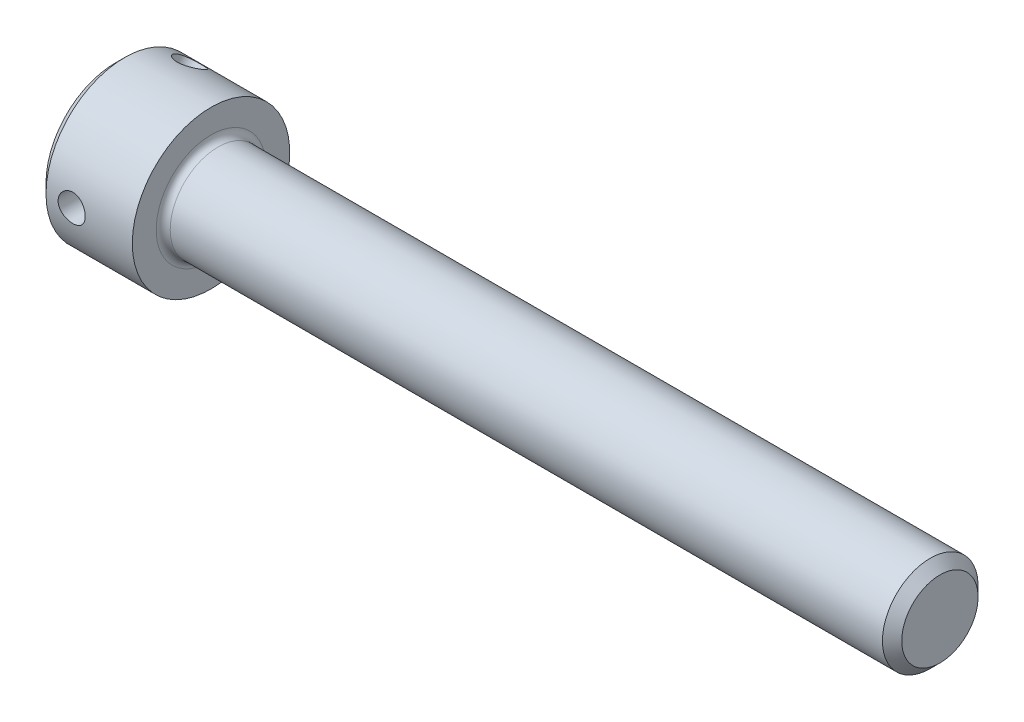
from build123d import *

# Parameters (mm, degrees)
FILLET1_R       = 0.3048
HEX_2_DEPTH     = 1.9558
SKETCH5_R       = 0.59055
HOLE_DEPTH      = 37.241501147
DRILLED_4_COUNT = 2
DRILLED_4_ANGLE = 60


with BuildPart() as part:
    # BodySke → Base-Revolve (revolve)
    with BuildSketch(Plane.XY):
        Polygon((0, 0), (0, 3.0226), (0.4064, 3.429), (4.1656, 3.429), (4.1656, 2.0828), (35.49523, 2.0828), (35.9156, 1.66243), (35.9156, 0), align=None)
    revolve(axis=Axis((-31.75, 0, 0), (1, 0, 0)))

    # Fillet1
    fillet1_edges = [part.edges().sort_by_distance(p)[0] for p in [
        (4.1656, -2.0828, 0),
    ]]
    fillet(fillet1_edges, radius=FILLET1_R)

    # Sketch2 → Hex-PreBroach (revolve, cut)
    with BuildSketch(Plane.XY):
        Polygon((0, 1.778), (1.9558, 1.778), (2.982328779, 0), (0, 0), align=None)
    revolve(axis=Axis((0, 0, 0), (1, 0, 0)), mode=Mode.SUBTRACT)

    # Sketch3 → Hex 2 (cut)
    with BuildSketch(Plane(origin=(0, 0, 0), x_dir=(0, 0.500000000000001, 0.866025403784438), z_dir=(-1, 0, 0))):
        Polygon((1.026528779, 1.778), (-1.026528779, 1.778), (-2.053057557, 0), (-1.026528779, -1.778), (1.026528779, -1.778), (2.053057557, 0), align=None)
    extrude(amount=-HEX_2_DEPTH, mode=Mode.SUBTRACT)

    # Sketch5 → Hole (cut, symmetric)
    with BuildSketch(Plane.XY):
        with Locations((1.524, 0)):
            Circle(SKETCH5_R)
    hole = extrude(amount=HOLE_DEPTH, both=True, mode=Mode.SUBTRACT)

    # Drilled-4: Hole ×2 about axis
    drilled_4_axis = Axis((0, 0, 0), (1, 0, 0))
    for i in range(1, DRILLED_4_COUNT):
        add(hole.rotate(drilled_4_axis, i * DRILLED_4_ANGLE / (DRILLED_4_COUNT - 1)), mode=Mode.SUBTRACT)


solid = part.part
